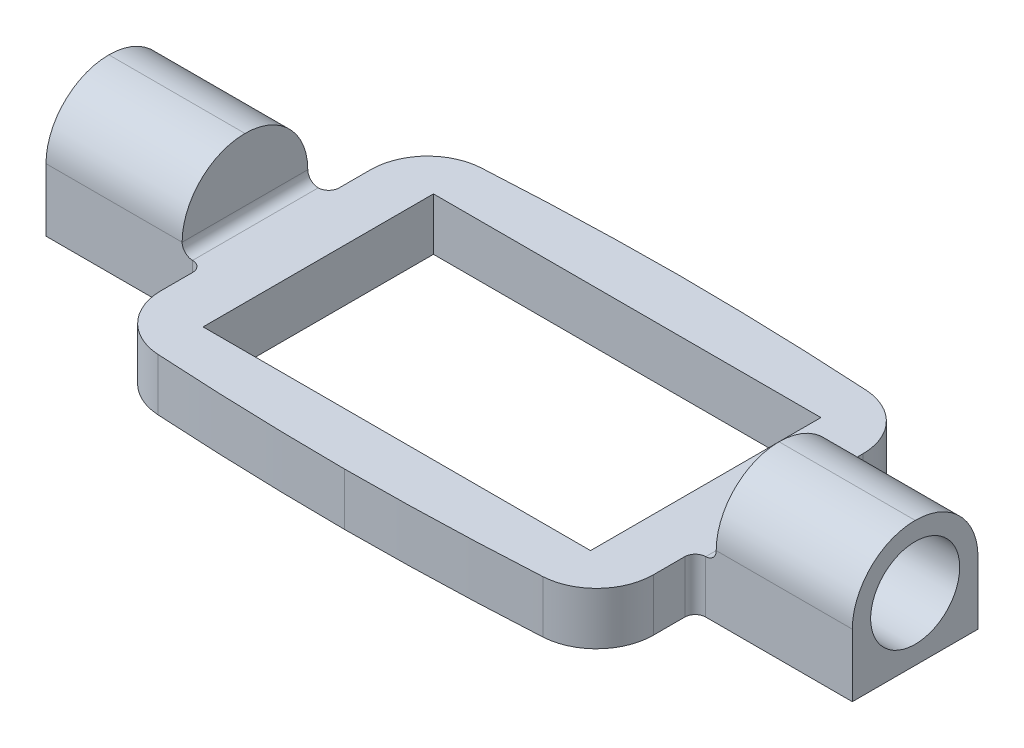
from build123d import *

# Parameters (mm, degrees)
SKETCH2_W           = 93.98
SKETCH2_H           = 55.88
BOSS_EXTRUDE1_DEPTH = 12.7
SKETCH3_W           = 33.02
SKETCH3_H           = 30.48
BOSS_EXTRUDE2_DEPTH = 17.78
FILLET1_R           = 2.54
SKETCH4_R           = 10.795
CUT_EXTRUDE1_DEPTH  = 25.4
CUT_EXTRUDE2_START  = -25.4
SKETCH5_R           = 10.795
CUT_EXTRUDE2_DEPTH  = 25.4
FILLET2_R           = 2.54
FILLET3_R           = 15.24


with BuildPart() as part:
    # Sketch2 → Boss-Extrude1 (new body)
    with BuildSketch(Plane(origin=(0, 0, 0), x_dir=(1, 0, 0), z_dir=(0, 1, 0))):
        with BuildLine():
            ThreePointArc((-93.688069253, -11.244332686), (-70.349230661, -12.298232488), (-46.99, -12.696270789))
            ThreePointArc((-46.99, -12.696270789), (-23.630769339, -12.298232488), (-0.291930747, -11.244332686))
            ThreePointArc((-0.291930747, -11.244332686), (8.940138318, -6.930983214), (12.7, 2.54))
            Line((12.7, 2.54), (12.7, 12.7))
            Line((12.7, 12.7), (50.8, 12.7))
            Line((50.8, 12.7), (50.8, 43.18))
            Line((50.8, 43.18), (12.7, 43.18))
            Line((12.7, 43.18), (12.7, 53.34))
            ThreePointArc((12.7, 53.34), (8.940138318, 62.810983214), (-0.291930747, 67.124332686))
            ThreePointArc((-0.291930747, 67.124332686), (-23.630769339, 68.178232488), (-46.99, 68.576270789))
            ThreePointArc((-46.99, 68.576270789), (-70.349230661, 68.178232488), (-93.688069253, 67.124332686))
            ThreePointArc((-93.688069253, 67.124332686), (-102.920138318, 62.810983214), (-106.68, 53.34))
            Line((-106.68, 53.34), (-106.68, 43.18))
            Line((-106.68, 43.18), (-144.78, 43.18))
            Line((-144.78, 43.18), (-144.78, 12.7))
            Line((-144.78, 12.7), (-106.68, 12.7))
            Line((-106.68, 12.7), (-106.68, 2.54))
            ThreePointArc((-106.68, 2.54), (-102.920138318, -6.930983214), (-93.688069253, -11.244332686))
        make_face()
        with Locations((-46.99, 27.94)):
            Rectangle(SKETCH2_W, SKETCH2_H, mode=Mode.SUBTRACT)
    extrude(amount=BOSS_EXTRUDE1_DEPTH)

    # Sketch3 → Boss-Extrude2 (add)
    with BuildSketch(Plane(origin=(0, 12.7, 0), x_dir=(1, 0, 0), z_dir=(0, 1, 0))):
        with Locations((34.29, 27.94)):
            Rectangle(SKETCH3_W, SKETCH3_H)
        with Locations((-128.27, 27.94)):
            Rectangle(SKETCH3_W, SKETCH3_H)
    extrude(amount=BOSS_EXTRUDE2_DEPTH)

    # Fillet1
    fillet1_edges = [part.edges().sort_by_distance(p)[0] for p in [
        (17.78, 12.7, -27.94),
        (-111.76, 12.7, -27.94),
    ]]
    fillet(fillet1_edges, radius=FILLET1_R)

    # Sketch4 → Cut-Extrude1 (cut)
    with BuildSketch(Plane(origin=(50.8, 0, 0), x_dir=(0, 0, -1), z_dir=(1, 0, 0))):
        with Locations((27.94, 15.24)):
            Circle(SKETCH4_R)
    extrude(amount=-CUT_EXTRUDE1_DEPTH, mode=Mode.SUBTRACT)

    # Sketch5 → Cut-Extrude2 (cut)
    with BuildSketch(Plane.ZY.offset(144.78).offset(CUT_EXTRUDE2_START)):
        with Locations(Location((-27.94, 15.24, 0), (0, 0, 180))):
            Circle(SKETCH5_R)
    extrude(amount=CUT_EXTRUDE2_DEPTH, mode=Mode.SUBTRACT)

    # Fillet2
    fillet2_edges = [part.edges().sort_by_distance(p)[0] for p in [
        (12.7, 6.35, -43.18),
        (12.7, 6.35, -12.7),
        (-106.68, 6.35, -43.18),
        (-106.68, 6.35, -12.7),
    ]]
    fillet(fillet2_edges, radius=FILLET2_R)

    # Fillet3
    fillet3_edges = [part.edges().sort_by_distance(p)[0] for p in [
        (34.29, 30.48, -43.18),
        (34.29, 30.48, -12.7),
        (-128.27, 30.48, -43.18),
        (-128.27, 30.48, -12.7),
    ]]
    fillet(fillet3_edges, radius=FILLET3_R - 0.0001)  # a hair under: the kernel refuses the full size


solid = part.part
